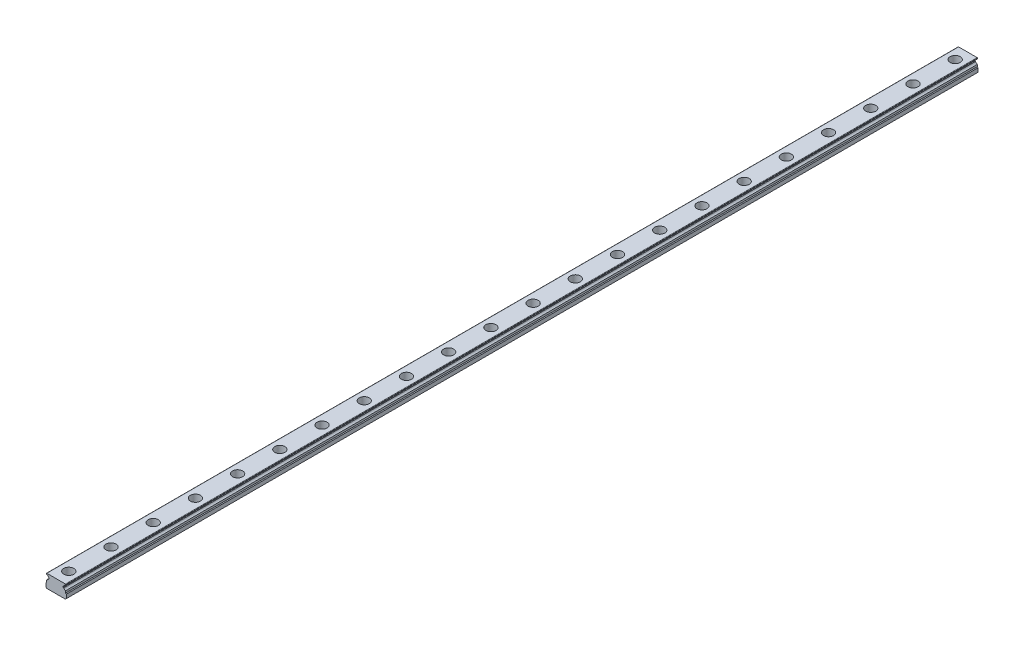
from build123d import *

# Parameters (mm, degrees)
BOSS_EXTRUDE1_DEPTH                              = 540
CUT_EXTRUDE1_DEPTH                               = 541.089659223
CUT_EXTRUDE2_DEPTH                               = 541.089659223
CUT_EXTRUDE3_START                               = -595
CUT_EXTRUDE3_DEPTH                               = 595
CBORE_FOR_M3_HEX_HEAD_MACHINE_SCREW1_D           = 3.5
CBORE_FOR_M3_HEX_HEAD_MACHINE_SCREW1_CBORE_D     = 6
CBORE_FOR_M3_HEX_HEAD_MACHINE_SCREW1_CBORE_DEPTH = 4.8
CHAMFER1_SIZE                                    = 0.5


with BuildPart() as part:
    # Sketch1 → Boss-Extrude1 (new body)
    with BuildSketch(Plane(origin=(0, 0, -595), x_dir=(-1, 0, 0), z_dir=(0, 0, -1))):
        with BuildLine():
            Line((5.671183896, 7.222941172), (5.741481457, 7.485295239))
            ThreePointArc((5.741481457, 7.485295239), (5.698338335, 7.702190357), (5.5, 7.8))
            Line((5.5, 7.8), (-5.5, 7.8))
            ThreePointArc((-5.5, 7.8), (-5.698338335, 7.702190357), (-5.741481457, 7.485295239))
            Line((-5.741481457, 7.485295239), (-5.671183896, 7.222941172))
            ThreePointArc((-5.671183896, 7.222941172), (-4.969714437, 6.868428854), (-4.556264014, 6.2))
            Line((-4.556264014, 6.2), (-4.1, 6.119548344))
            Line((-4.1, 6.119548344), (-4.1, 5.480451656))
            Line((-4.1, 5.480451656), (-6, 5.145430393))
            Line((-6, 5.145430393), (-6, 0))
            Line((-6, 0), (6, 0))
            Line((6, 0), (6, 2.8))
            Line((6, 2.8), (5.6, 3.2))
            Line((5.6, 3.2), (5.6, 4.392875272))
            ThreePointArc((5.6, 4.392875272), (4.500458461, 5.836459934), (5.671183896, 7.222941172))
        make_face()
    extrude(amount=-BOSS_EXTRUDE1_DEPTH)

    # Sketch2 → Cut-Extrude1 (cut, through all)
    with BuildSketch(Plane.XY.offset(-55)):
        Polygon((5.6, 5.215961185), (5.6, 3.2), (6, 2.8), (6, 5.145430393), align=None)
    extrude(amount=-CUT_EXTRUDE1_DEPTH, mode=Mode.SUBTRACT)

    # Sketch3 → Cut-Extrude2 (cut, through all)
    with BuildSketch(Plane.XY.offset(-55)):
        with BuildLine():
            Line((5.6, 5.215961185), (4.556264014, 5.4))
            ThreePointArc((4.556264014, 5.4), (4.943158974, 4.756558028), (5.6, 4.392875272))
            Line((5.6, 4.392875272), (5.6, 5.215961185))
        make_face()
    extrude(amount=-CUT_EXTRUDE2_DEPTH, mode=Mode.SUBTRACT)

    # Sketch4 → Cut-Extrude3 (cut)
    with BuildSketch(Plane.XY.offset(-55).offset(CUT_EXTRUDE3_START)):
        with BuildLine():
            Line((-4.556264014, 5.4), (-4.1, 5.480451656))
            Line((-4.1, 5.480451656), (-4.1, 6.119548344))
            Line((-4.1, 6.119548344), (-4.556264014, 6.2))
            ThreePointArc((-4.556264014, 6.2), (-4.5, 5.8), (-4.556264014, 5.4))
        make_face()
    extrude(amount=CUT_EXTRUDE3_DEPTH, mode=Mode.SUBTRACT)

    # CBORE for M3 Hex Head Machine Screw1 (through all)
    with Locations(Plane(origin=(0, 7.8, 0), x_dir=(1, 0, 0), z_dir=(0, 1, 0))):
        with Locations((0, 587.5), (0, 562.5), (0, 537.5), (0, 512.5), (0, 487.5), (0, 462.5), (0, 437.5), (0, 412.5), (0, 387.5), (0, 362.5), (0, 337.5), (0, 312.5), (0, 287.5), (0, 262.5), (0, 237.5), (0, 212.5), (0, 187.5), (0, 162.5), (0, 137.5), (0, 112.5), (0, 87.5), (0, 62.5)):
            CounterBoreHole(CBORE_FOR_M3_HEX_HEAD_MACHINE_SCREW1_D / 2, CBORE_FOR_M3_HEX_HEAD_MACHINE_SCREW1_CBORE_D / 2, CBORE_FOR_M3_HEX_HEAD_MACHINE_SCREW1_CBORE_DEPTH)

    # Chamfer1
    chamfer1_edges = [part.edges().sort_by_distance(p)[0] for p in [
        (-6, 0, -325),
        (6, 0, -325),
    ]]
    chamfer(chamfer1_edges, length=CHAMFER1_SIZE)


solid = part.part
